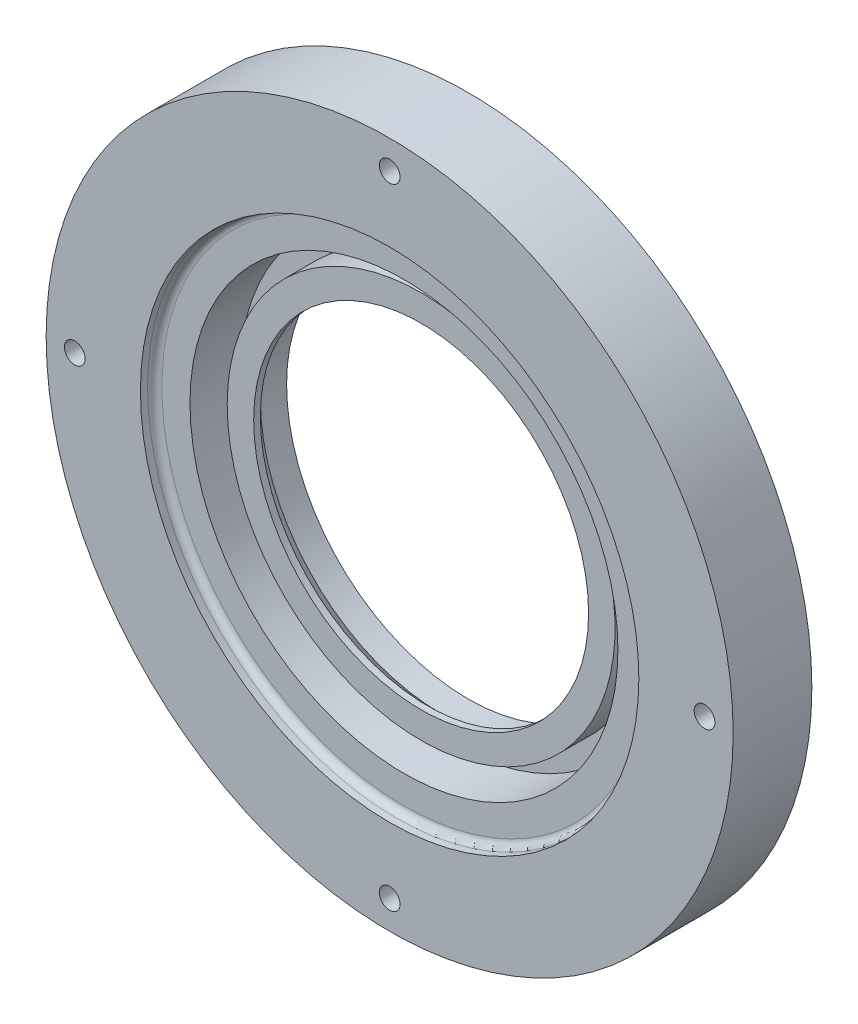
from build123d import *

# Parameters (mm, degrees)
FILLET1_R                        = 1
CBORE_FOR_M2_5_SHCS1_D           = 2.9
CBORE_FOR_M2_5_SHCS1_DEPTH       = 11
CBORE_FOR_M2_5_SHCS1_CBORE_D     = 5.5
CBORE_FOR_M2_5_SHCS1_CBORE_DEPTH = 5.5
CBORE_FOR_M2_5_SHCS1_TIP         = 0.871247898


with BuildPart() as part:
    # Sketch2 → Revolve1 (revolve)
    with BuildSketch(Plane(origin=(149.116436894, 233.039279035, -142.529295826), x_dir=(0.7966051698338124, 0.6044999614508201, 0), z_dir=(-0.6044999614508201, 0.7966051698338124, 0))):
        Polygon((-23.4, 2.4), (-23.4, 3.334314575), (-25.4, 5.334314575), (-25.4, 9), (-48, 9), (-48, -2), (-34.825, -2), (-34.825, 0), (-29.9, 0), (-29.9, 7), (-27.1, 7), (-27.1, 2.4), align=None)
    revolve(axis=Axis((149.116436894, 233.039279035, -155.970002237), (0, 0, 1)))

    # Fillet1
    fillet1_edges = [part.edges().sort_by_distance(p)[0] for p in [
        (176.858211933, 254.090990192, -142.529295826),
    ]]
    fillet(fillet1_edges, radius=FILLET1_R)

    # CBORE for M2.5 SHCS1
    with Locations(Plane(origin=(0, 0, -151.529295826), x_dir=(-1, 0, 0), z_dir=(0, 0, -1))):
        with Locations((-149.116436894, 277.039279035), (-149.116436894, 189.039279035), (-105.116436894, 233.039279035), (-193.116436894, 233.039279035)):
            CounterBoreHole(CBORE_FOR_M2_5_SHCS1_D / 2, CBORE_FOR_M2_5_SHCS1_CBORE_D / 2, CBORE_FOR_M2_5_SHCS1_CBORE_DEPTH, depth=CBORE_FOR_M2_5_SHCS1_DEPTH)
            with Locations((0, 0, -(CBORE_FOR_M2_5_SHCS1_DEPTH + CBORE_FOR_M2_5_SHCS1_TIP / 2))):  # 118° drill point
                Cone(0, CBORE_FOR_M2_5_SHCS1_D / 2, CBORE_FOR_M2_5_SHCS1_TIP, mode=Mode.SUBTRACT)


solid = part.part
